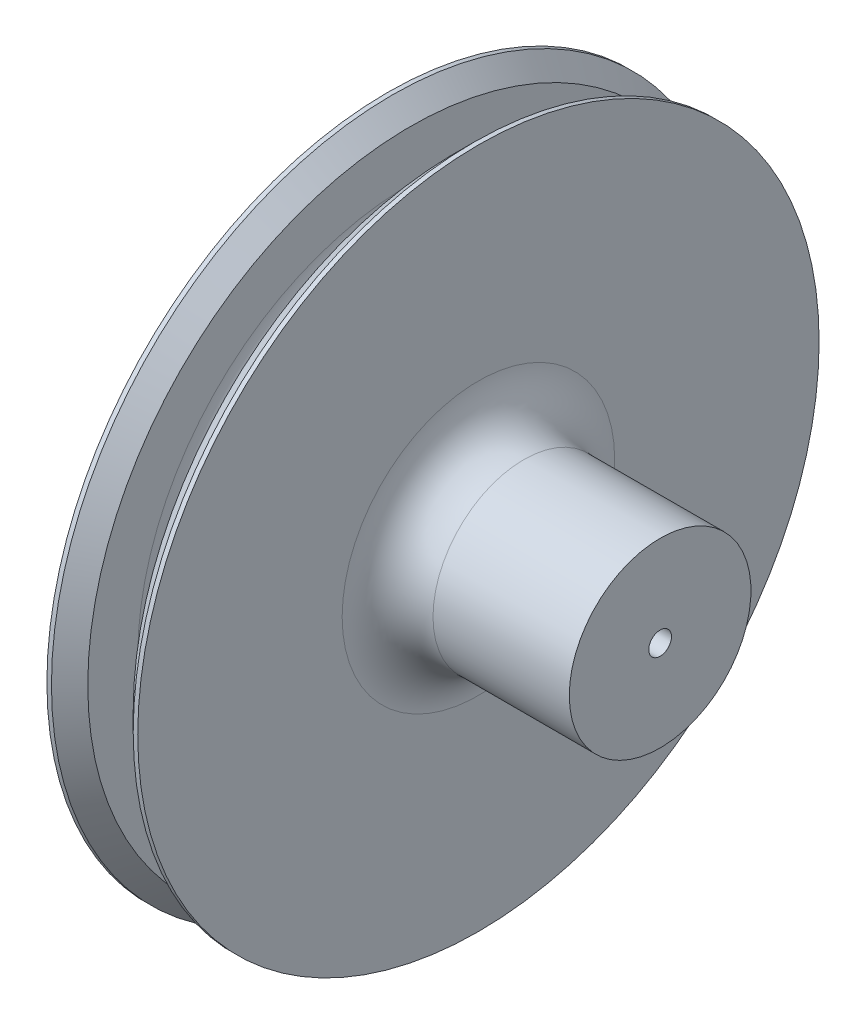
from build123d import *

# Parameters (mm, degrees)
BOSS_EXTRUDE1_DEPTH      = 3.175
BOSS_EXTRUDE1_DEPTH_BACK = 19.05
SKETCH2_R                = 6.35
CUT_EXTRUDE1_DEPTH       = 41.348741461
CUT_EXTRUDE1_DEPTH_BACK  = 41.348741461
SKETCH3_R                = 0.79375
FILLET1_R                = 3.175
CHAMFER1_SIZE            = 1.27


with BuildPart() as part:
    # Sketch1 → Revolve1 (revolve)
    with BuildSketch(Plane.XY, mode=Mode.PRIVATE) as revolve1_sk:
        with BuildLine():
            Line((-1.5875, -19.05), (-1.5875, -23.8125))
            Line((-1.5875, -23.8125), (-3.175, -23.8125))
            Line((-3.175, -23.8125), (-3.175, 0))
            Line((-3.175, 0), (3.175, 0))
            Line((3.175, 0), (3.175, -23.8125))
            Line((3.175, -23.8125), (1.5875, -23.8125))
            Line((1.5875, -23.8125), (1.5875, -19.05))
            ThreePointArc((1.5875, -19.05), (0, -17.4625), (-1.5875, -19.05))
        make_face()
    revolve(revolve1_sk.sketch.rotate(Axis((-3.175, 0, 0), (1, 0, 0)), 270), axis=Axis((-3.175, 0, 0), (1, 0, 0)))

    # Sketch2 → Boss-Extrude1 (add, two sides: drawn at the far end of the back side and taken through both)
    with BuildSketch(Plane.ZY.offset(3.175).offset(-BOSS_EXTRUDE1_DEPTH_BACK)):
        Circle(SKETCH2_R)
    extrude(amount=BOSS_EXTRUDE1_DEPTH + BOSS_EXTRUDE1_DEPTH_BACK)

    # Sketch3 → Cut-Extrude1 (cut, two sides: drawn at the far end of the back side and taken through both)
    with BuildSketch(Plane.ZY.offset(6.35).offset(-CUT_EXTRUDE1_DEPTH_BACK)):
        Circle(SKETCH3_R)
    extrude(amount=CUT_EXTRUDE1_DEPTH + CUT_EXTRUDE1_DEPTH_BACK, mode=Mode.SUBTRACT)

    # Fillet1
    fillet1_edges = [part.edges().sort_by_distance(p)[0] for p in [
        (-3.175, 0, -6.35),
        (3.175, 0, -6.35),
    ]]
    fillet(fillet1_edges, radius=FILLET1_R - 0.0001)  # a hair under: the kernel refuses the full size

    # Chamfer1
    chamfer1_edges = [part.edges().sort_by_distance(p)[0] for p in [
        (-1.5875, 0, -23.8125),
        (1.5875, 0, -23.8125),
    ]]
    chamfer(chamfer1_edges, length=CHAMFER1_SIZE)


solid = part.part
